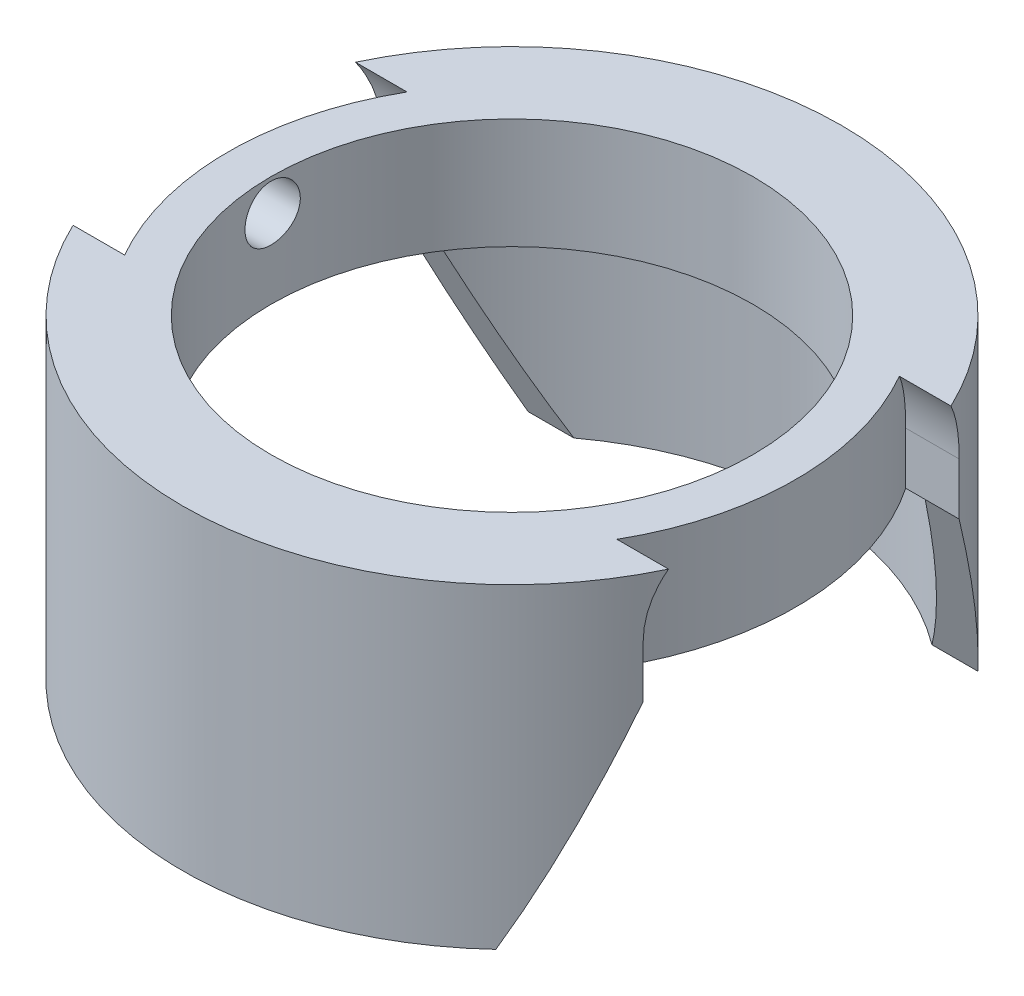
from build123d import *
from build123d.topology import SkipClean

# Parameters (mm, degrees)
ESQUISSE1_R                   = 17.963
ESQUISSE1_R_2                 = 15.25
BOSS_EXTRU_1_DEPTH            = 40.144083067
CHANFREIN1_SIZE               = 2
ESQUISSE7_R                   = 17.963
BOSS_EXTRU_4_DEPTH            = 25
ESQUISSE8_R                   = 15.25
ENL_V_MAT_EXTRU_3_DEPTH       = 48.506695773
BOSS_EXTRU_5_DEPTH            = 130
ENL_V_MAT_EXTRU_8_DEPTH       = 134.304428503
ENL_V_MAT_EXTRU_8_DEPTH_BACK  = 134.304428503
ENL_V_MAT_EXTRU_9_DEPTH       = 130
ENL_V_MAT_EXTRU_9_DEPTH_BACK  = 130
ESQUISSE21_R                  = 17.963
ESQUISSE21_R_2                = 15.25
BOSS_EXTRU_6_DEPTH            = 65.144083
ESQUISSE22_R                  = 1.75
ENL_V_MAT_EXTRU_10_DEPTH      = 64
ESQUISSE23_R                  = 1.75
ENL_V_MAT_EXTRU_11_DEPTH      = 64
R_P_TITION_LIN_AIRE2_COUNT    = 2
R_P_TITION_LIN_AIRE2_PITCH    = 16
CONG_2_R                      = 7
ESQUISSE11_R                  = 1.5
ESQUISSE24_R                  = 20.85750055
BOSS_EXTRU_10_DEPTH           = 13
ESQUISSE26_R                  = 15.25
ENL_V_MAT_EXTRU_12_DEPTH      = 134.304428631
ENL_V_MAT_EXTRU_13_DEPTH      = 134.304428631
ENL_V_MAT_EXTRU_13_DEPTH_BACK = 134.304428631
ESQUISSE29_R                  = 19
ENL_V_MAT_EXTRU_14_DEPTH      = 13
ESQUISSE31_R                  = 30.102182373
ENL_V_MAT_EXTRU_15_DEPTH      = 123


with BuildPart() as part:
    # Esquisse1 → Boss.-Extru.1 (new body)
    with BuildSketch(Plane(origin=(0, 0, 0), x_dir=(1, 0, 0), z_dir=(0, 1, 0))):
        with Locations(Location((0, 0, 0), (0, 0, 270))):
            Circle(ESQUISSE1_R)
        with Locations(Location((0, 0, 0), (0, 0, 270))):
            Circle(ESQUISSE1_R_2, mode=Mode.SUBTRACT)
    extrude(amount=BOSS_EXTRU_1_DEPTH)

    # Chanfrein1
    chanfrein1_edges = [part.edges().sort_by_distance(p)[0] for p in [
        (0, 0, -17.963),
    ]]
    chamfer(chanfrein1_edges, length=CHANFREIN1_SIZE)

    # Esquisse7 → Boss.-Extru.4 (add)
    with BuildSketch(Plane(origin=(0, 40.144083067, 0), x_dir=(1, 0, 0), z_dir=(0, 1, 0))):
        with Locations(Location((0, 0, 0), (0, 0, 270))):
            Circle(ESQUISSE7_R)
    extrude(amount=BOSS_EXTRU_4_DEPTH)

    # Esquisse8 → Enlèv. mat.-Extru.3 (cut, through all)
    with BuildSketch(Plane.XZ.offset(-40.144083067)):
        with Locations(Location((0, 0, 0), (0, 0, 270))):
            Circle(ESQUISSE8_R)
    extrude(amount=-ENL_V_MAT_EXTRU_3_DEPTH, mode=Mode.SUBTRACT)

    # Esquisse10 → Boss.-Extru.5 (add)
    with BuildSketch(Plane(origin=(0, 0, 0), x_dir=(1, 0, 0), z_dir=(0, 1, 0))):
        with BuildLine():
            Line((20.85750055, 0), (17.963, 0))
            ThreePointArc((17.963, 0), (0, -17.963), (-17.963, 0))
            Line((-17.963, 0), (-20.85750055, 0))
            ThreePointArc((-20.85750055, 0), (0, -20.85750055), (20.85750055, 0))
        make_face()
    boss_extru_5 = extrude(amount=BOSS_EXTRU_5_DEPTH)

    # Symétrie3: Boss.-Extru.5 across plane
    with SkipClean():  # the faces are left unmerged after this step: merging them gives an invalid solid
        add(boss_extru_5.mirror(Plane.XY))

    # Esquisse18 → Enlèv. mat.-Extru.8 (cut, two sides: drawn at the far end of the back side and taken through both)
    with SkipClean():  # the faces are left unmerged after this step: merging them gives an invalid solid
        with BuildSketch(Plane(origin=(0, 0, 0), x_dir=(0, 0, -1), z_dir=(1, 0, 0)).offset(-ENL_V_MAT_EXTRU_8_DEPTH_BACK)):
            Polygon((-10, 121.154286311), (-13.911254963, 130), (13.911254963, 130), (10, 121.154286311), (10, 61.262819373), (-10, 61.262819373), align=None)
        extrude(amount=ENL_V_MAT_EXTRU_8_DEPTH + ENL_V_MAT_EXTRU_8_DEPTH_BACK, mode=Mode.SUBTRACT)

    # Esquisse20 → Enlèv. mat.-Extru.9 (cut, two sides: drawn at the far end of the back side and taken through both)
    with BuildSketch(Plane(origin=(0, 0, 0), x_dir=(0, 0, -1), z_dir=(1, 0, 0)).offset(-ENL_V_MAT_EXTRU_9_DEPTH_BACK)):
        Polygon((-5, 61.262819373), (5, 61.262819373), (5, 10.002819373), (10, 10.002819373), (10, 0), (-10, 0), (-10, 10.002819373), (-5, 10.002819373), align=None)
    extrude(amount=ENL_V_MAT_EXTRU_9_DEPTH + ENL_V_MAT_EXTRU_9_DEPTH_BACK, mode=Mode.SUBTRACT)


with BuildPart() as enl_v_mat_extru_9_piece_1:
    # of the separate pieces the step leaves, piece 1, a body of its own (enl_v_mat_extru_9_pieces)
    add(part.part.solids().sort_by_distance((-18.303970313, 0, -10))[0])



with BuildPart() as enl_v_mat_extru_9_piece_2:
    # of the separate pieces the step leaves, piece 2, a body of its own (enl_v_mat_extru_9_pieces)
    add(part.part.solids().sort_by_distance((-15.540666477, 130, 13.911254963))[0])


with BuildPart() as enl_v_mat_extru_9_piece_1_1:
    with SkipClean():  # the faces are left unmerged after this step: merging them gives an invalid solid
        add(enl_v_mat_extru_9_piece_1.part)

        add(enl_v_mat_extru_9_piece_2.part)  # Boss.-Extru.6 merges Enlèv. mat.-Extru.9 piece 2
        # Esquisse21 → Boss.-Extru.6 (add)
        with BuildSketch(Plane(origin=(0, 0, 0), x_dir=(1, 0, 0), z_dir=(0, 1, 0))):
            Circle(ESQUISSE21_R)
            with Locations(Location((0, 0, 0), (0, 0, 90))):
                Circle(ESQUISSE21_R_2, mode=Mode.SUBTRACT)
        extrude(amount=BOSS_EXTRU_6_DEPTH)

    # Esquisse22 → Enlèv. mat.-Extru.10 (cut)
    with SkipClean():  # the faces are left unmerged after this step: merging them gives an invalid solid
        with BuildSketch(Plane(origin=(0, 0, 0), x_dir=(0, 0, -1), z_dir=(1, 0, 0))):
            with Locations((0, 5)):
                Circle(ESQUISSE22_R)
        enl_v_mat_extru_10 = extrude(amount=-ENL_V_MAT_EXTRU_10_DEPTH, mode=Mode.SUBTRACT)

    # Esquisse23 → Enlèv. mat.-Extru.11 (cut)
    with SkipClean():  # the faces are left unmerged after this step: merging them gives an invalid solid
        with BuildSketch(Plane(origin=(0, 0, 0), x_dir=(0, 0, -1), z_dir=(1, 0, 0))):
            with Locations(Location((0, 13.3, 0), (0, 0, 180))):
                Circle(ESQUISSE23_R)
        extrude(amount=ENL_V_MAT_EXTRU_11_DEPTH, mode=Mode.SUBTRACT)

    # Répétition linéaire2: Enlèv. mat.-Extru.10 ×2
    with SkipClean():  # the faces are left unmerged after this step: merging them gives an invalid solid
        with Locations(*[(0, i * R_P_TITION_LIN_AIRE2_PITCH, 0) for i in range(1, R_P_TITION_LIN_AIRE2_COUNT)]):
            add(enl_v_mat_extru_10, mode=Mode.SUBTRACT)

    # Congé2
    # the kernel refuses this fillet: 7 mm, written as the material it adds along each edge
    with BuildSketch(Plane(origin=(-35.074480144, 61.262819373, 10), x_dir=(0, 1, 0), z_dir=(1, 0, 0))) as cong_2_piece_1_section:
        with BuildLine():
            CenterArc((6.708203932, -7), CONG_2_R, 90, 73.398450401)
            Line((0, -5), (-0.134164079, -4.96))
            ThreePointArc((-0.134164079, -4.96), (-0.14, -2.5), (-0.14, 0))
            Line((-0.14, 0), (0, 0.14))
            Line((0, 0.14), (6.708203932, 0.14))
            Line((6.708203932, 0.14), (6.708203932, 0))
        make_face()
    cong_2_piece_1 = extrude(amount=36.922879903, mode=Mode.PRIVATE)
    cong_2_piece_1 = cong_2_piece_1 & Plane(origin=(0, 62.883538638, 0), x_dir=(-1, 0, 0), z_dir=(0, -1, 0)) * Cylinder(20.85750055, 101, mode=Mode.PRIVATE)
    cong_2_piece_1 = cong_2_piece_1 - Plane(origin=(0, 62.883538638, 0), x_dir=(1, 0, 0), z_dir=(0, -1, 0)) * Cylinder(17.963, 101, mode=Mode.PRIVATE)
    add(cong_2_piece_1)
    with BuildSketch(Plane(origin=(-1.848399759, 61.262819373, 10), x_dir=(0, 0, -1), z_dir=(1, 0, 0))) as cong_2_piece_2_section:
        with BuildLine():
            CenterArc((7, 6.708203932), CONG_2_R, 180, 73.398450401)
            Line((0, 6.708203932), (-0.14, 6.708203932))
            Line((-0.14, 6.708203932), (-0.14, 0))
            Line((-0.14, 0), (0, -0.14))
            ThreePointArc((0, -0.14), (2.5, -0.14), (4.96, -0.134164079))
            Line((4.96, -0.134164079), (5, 0))
        make_face()
    cong_2_piece_2 = extrude(amount=36.922879903, mode=Mode.PRIVATE)
    cong_2_piece_2 = cong_2_piece_2 & Plane(origin=(0, 62.883538658, 0), x_dir=(-1, 0, 0), z_dir=(0, -1, 0)) * Cylinder(20.85750055, 101, mode=Mode.PRIVATE)
    cong_2_piece_2 = cong_2_piece_2 - Plane(origin=(0, 62.883538658, 0), x_dir=(1, 0, 0), z_dir=(0, -1, 0)) * Cylinder(17.963, 101, mode=Mode.PRIVATE)
    add(cong_2_piece_2)
    with BuildSketch(Plane(origin=(-1.848399759, 61.262819373, -10), x_dir=(0, 0, 1), z_dir=(1, 0, 0))) as cong_2_piece_3_section:
        with BuildLine():
            CenterArc((7, -6.708203932), CONG_2_R, 106.601549599, 73.398450401)
            Line((0, -6.708203932), (-0.14, -6.708203932))
            Line((-0.14, -6.708203932), (-0.14, 0))
            Line((-0.14, 0), (0, 0.14))
            ThreePointArc((0, 0.14), (2.5, 0.14), (4.96, 0.134164079))
            Line((4.96, 0.134164079), (5, 0))
        make_face()
    cong_2_piece_3 = extrude(amount=36.922879903, mode=Mode.PRIVATE)
    cong_2_piece_3 = cong_2_piece_3 & Plane(origin=(0, 62.883538748, 0), x_dir=(-1, 0, 0), z_dir=(0, -1, 0)) * Cylinder(20.85750055, 101, mode=Mode.PRIVATE)
    cong_2_piece_3 = cong_2_piece_3 - Plane(origin=(0, 62.883538748, 0), x_dir=(1, 0, 0), z_dir=(0, -1, 0)) * Cylinder(17.963, 101, mode=Mode.PRIVATE)
    add(cong_2_piece_3)
    with BuildSketch(Plane(origin=(-35.074480144, 61.262819373, -10), x_dir=(0, 0, 1), z_dir=(1, 0, 0))) as cong_2_piece_4_section:
        with BuildLine():
            CenterArc((7, -6.708203932), CONG_2_R, 106.601549599, 73.398450401)
            Line((0, -6.708203932), (-0.14, -6.708203932))
            Line((-0.14, -6.708203932), (-0.14, 0))
            Line((-0.14, 0), (0, 0.14))
            ThreePointArc((0, 0.14), (2.5, 0.14), (4.96, 0.134164079))
            Line((4.96, 0.134164079), (5, 0))
        make_face()
    cong_2_piece_4 = extrude(amount=36.922879903, mode=Mode.PRIVATE)
    cong_2_piece_4 = cong_2_piece_4 & Plane(origin=(0, 62.883538616, 0), x_dir=(-1, 0, 0), z_dir=(0, -1, 0)) * Cylinder(20.85750055, 101, mode=Mode.PRIVATE)
    cong_2_piece_4 = cong_2_piece_4 - Plane(origin=(0, 62.883538616, 0), x_dir=(1, 0, 0), z_dir=(0, -1, 0)) * Cylinder(17.963, 101, mode=Mode.PRIVATE)
    add(cong_2_piece_4)
    with BuildSketch(Plane(origin=(1.848399759, 10.002819373, -10), x_dir=(0, -1, 0), z_dir=(-1, 0, 0))) as cong_2_piece_5_section:
        with BuildLine():
            CenterArc((6.708203932, 7), CONG_2_R, 196.601549599, 73.398450401)
            Line((0, 5), (-0.134164079, 4.96))
            ThreePointArc((-0.134164079, 4.96), (-0.14, 2.5), (-0.14, 0))
            Line((-0.14, 0), (0, -0.14))
            Line((0, -0.14), (6.708203932, -0.14))
            Line((6.708203932, -0.14), (6.708203932, 0))
        make_face()
    cong_2_piece_5 = extrude(amount=36.922879903, mode=Mode.PRIVATE)
    cong_2_piece_5 = cong_2_piece_5 - Plane(origin=(0, 8.382100154, 0), x_dir=(1, 0, 0), z_dir=(0, -1, 0)) * Cylinder(17.963, 101, mode=Mode.PRIVATE)
    cong_2_piece_5 = cong_2_piece_5 & Plane(origin=(0, 8.382100154, 0), x_dir=(-1, 0, 0), z_dir=(0, -1, 0)) * Cylinder(20.85750055, 101, mode=Mode.PRIVATE)
    add(cong_2_piece_5)
    with BuildSketch(Plane(origin=(35.074480144, 10.002819373, -10), x_dir=(0, -1, 0), z_dir=(-1, 0, 0))) as cong_2_piece_6_section:
        with BuildLine():
            CenterArc((6.708203932, 7), CONG_2_R, 196.601549599, 73.398450401)
            Line((0, 5), (-0.134164079, 4.96))
            ThreePointArc((-0.134164079, 4.96), (-0.14, 2.5), (-0.14, 0))
            Line((-0.14, 0), (0, -0.14))
            Line((0, -0.14), (6.708203932, -0.14))
            Line((6.708203932, -0.14), (6.708203932, 0))
        make_face()
    cong_2_piece_6 = extrude(amount=36.922879903, mode=Mode.PRIVATE)
    cong_2_piece_6 = cong_2_piece_6 - Plane(origin=(0, 8.38209993, 0), x_dir=(1, 0, 0), z_dir=(0, -1, 0)) * Cylinder(17.963, 101, mode=Mode.PRIVATE)
    cong_2_piece_6 = cong_2_piece_6 & Plane(origin=(0, 8.38209993, 0), x_dir=(-1, 0, 0), z_dir=(0, -1, 0)) * Cylinder(20.85750055, 101, mode=Mode.PRIVATE)
    add(cong_2_piece_6)
    with BuildSketch(Plane(origin=(-1.848399759, 10.002819373, 10), x_dir=(0, -1, 0), z_dir=(1, 0, 0))) as cong_2_piece_7_section:
        with BuildLine():
            CenterArc((6.708203932, 7), CONG_2_R, 196.601549599, 73.398450401)
            Line((0, 5), (-0.134164079, 4.96))
            ThreePointArc((-0.134164079, 4.96), (-0.14, 2.5), (-0.14, 0))
            Line((-0.14, 0), (0, -0.14))
            Line((0, -0.14), (6.708203932, -0.14))
            Line((6.708203932, -0.14), (6.708203932, 0))
        make_face()
    cong_2_piece_7 = extrude(amount=36.922879903, mode=Mode.PRIVATE)
    cong_2_piece_7 = cong_2_piece_7 & Plane(origin=(0, 8.382100073, 0), x_dir=(-1, 0, 0), z_dir=(0, -1, 0)) * Cylinder(20.85750055, 101, mode=Mode.PRIVATE)
    cong_2_piece_7 = cong_2_piece_7 - Plane(origin=(0, 8.382100073, 0), x_dir=(1, 0, 0), z_dir=(0, -1, 0)) * Cylinder(17.963, 101, mode=Mode.PRIVATE)
    add(cong_2_piece_7)
    with BuildSketch(Plane(origin=(-35.074480144, 10.002819373, 10), x_dir=(0, 0, -1), z_dir=(1, 0, 0))) as cong_2_piece_8_section:
        with BuildLine():
            CenterArc((7, -6.708203932), CONG_2_R, 106.601549599, 73.398450401)
            Line((0, -6.708203932), (-0.14, -6.708203932))
            Line((-0.14, -6.708203932), (-0.14, 0))
            Line((-0.14, 0), (0, 0.14))
            ThreePointArc((0, 0.14), (2.5, 0.14), (4.96, 0.134164079))
            Line((4.96, 0.134164079), (5, 0))
        make_face()
    cong_2_piece_8 = extrude(amount=36.922879903, mode=Mode.PRIVATE)
    cong_2_piece_8 = cong_2_piece_8 & Plane(origin=(0, 8.382100055, 0), x_dir=(-1, 0, 0), z_dir=(0, -1, 0)) * Cylinder(20.85750055, 101, mode=Mode.PRIVATE)
    cong_2_piece_8 = cong_2_piece_8 - Plane(origin=(0, 8.382100055, 0), x_dir=(1, 0, 0), z_dir=(0, -1, 0)) * Cylinder(17.963, 101, mode=Mode.PRIVATE)
    add(cong_2_piece_8)

    # Balayage3: sweep along a curve in space
    with BuildLine() as balayage3_path:
        ThreePointArc((0, 65.144083067, -15.25), (10.783378413, 65.144083067, -10.783378413), (15.25, 65.144083067, 0))
        ThreePointArc((15.25, 65.144083067, 0), (10.783378413, 65.144083067, 10.783378413), (0, 65.144083067, 15.25))
        ThreePointArc((0, 65.144083067, 15.25), (-10.783378413, 65.144083067, 10.783378413), (-15.25, 65.144083067, 0))
        ThreePointArc((-15.25, 65.144083067, 0), (-10.783378413, 65.144083067, -10.783378413), (0, 65.144083067, -15.25))
    # Esquisse11 → Balayage3 (sweep)
    with BuildSketch(Plane(origin=(0, 0, 0), x_dir=(0, 0, -1), z_dir=(1, 0, 0))):
        with Locations((17.963, 65.144083067)):
            Circle(ESQUISSE11_R)
    sweep(path=balayage3_path.line)

    # Esquisse24 → Boss.-Extru.10 (add)
    with BuildSketch(Plane(origin=(0, 0, 0), x_dir=(1, 0, 0), z_dir=(0, 1, 0))):
        with Locations(Location((0, 0, 0), (0, 0, 41.83337037))):
            Circle(ESQUISSE24_R)
    extrude(amount=-BOSS_EXTRU_10_DEPTH)

    # Esquisse26 → Enlèv. mat.-Extru.12 (cut, through all)
    with SkipClean():  # the faces are left unmerged after this step: merging them gives an invalid solid
        with BuildSketch(Plane(origin=(0, 0, 0), x_dir=(1, 0, 0), z_dir=(0, 1, 0))):
            with Locations(Location((0, 0, 0), (0, 0, 90))):
                Circle(ESQUISSE26_R)
        extrude(amount=-ENL_V_MAT_EXTRU_12_DEPTH, mode=Mode.SUBTRACT)
    add(enl_v_mat_extru_9_piece_1_1.part.scale(1), mode=Mode.REPLACE)  # the faces are merged on a copy

    # Esquisse27 → Enlèv. mat.-Extru.13 (cut, two sides: drawn at the far end of the back side and taken through both)
    with SkipClean():  # the faces are left unmerged after this step: merging them gives an invalid solid
        with BuildSketch(Plane(origin=(0, 0, 0), x_dir=(0, 0, -1), z_dir=(1, 0, 0)).offset(-ENL_V_MAT_EXTRU_13_DEPTH_BACK)):
            Polygon((-10, 0), (-15.25, -13), (15.25, -13), (10, 0), align=None)
        extrude(amount=ENL_V_MAT_EXTRU_13_DEPTH + ENL_V_MAT_EXTRU_13_DEPTH_BACK, mode=Mode.SUBTRACT)

    # Esquisse29 → Enlèv. mat.-Extru.14 (cut)
    with BuildSketch(Plane(origin=(0, 0, 0), x_dir=(1, 0, 0), z_dir=(0, 1, 0))):
        Circle(ESQUISSE29_R)
    extrude(amount=-ENL_V_MAT_EXTRU_14_DEPTH, mode=Mode.SUBTRACT)

    # Esquisse31 → Enlèv. mat.-Extru.15 (cut)
    with BuildSketch(Plane(origin=(0, 130, 0), x_dir=(1, 0, 0), z_dir=(0, 1, 0))):
        Circle(ESQUISSE31_R)
    extrude(amount=-ENL_V_MAT_EXTRU_15_DEPTH, mode=Mode.SUBTRACT)


solid = enl_v_mat_extru_9_piece_1_1.part
